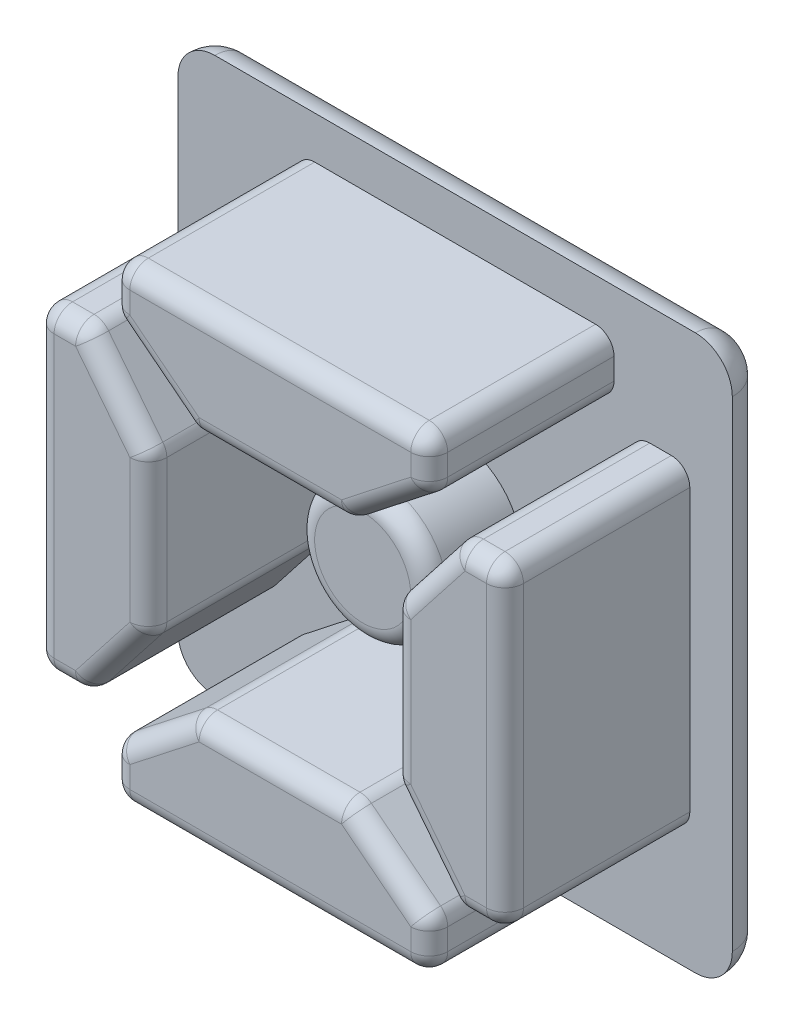
from build123d import *

# Parameters (mm, degrees)
ESQUISSE1_W                        = 30
ESQUISSE1_H                        = 30
BOSS_EXTRU_1_DEPTH                 = 2
BOSS_EXTRU_5_DEPTH                 = 10
CONG_1_R                           = 1
ESQUISSE2_R                        = 3.6
BOSS_EXTRU_6_DEPTH                 = 5
R_P_TITION_CIRCULAIRE1_COUNT       = 4
CONG_1_OF_R_P_TITION_CIRCULAIRE1_R = 1
CONG_2_R                           = 2
CONG_3_R                           = 1
CONG_4_R                           = 2


with BuildPart() as part:
    # Esquisse1 → Boss.-Extru.1 (new body)
    with BuildSketch(Plane.XY):
        with Locations((15, 15)):
            Rectangle(ESQUISSE1_W, ESQUISSE1_H)
    extrude(amount=BOSS_EXTRU_1_DEPTH)

    # Esquisse5 → Boss.-Extru.5 (add)
    with BuildSketch(Plane.XY.offset(2)):
        Polygon((27.7, 6.4), (27.7, 23.6), (25.05, 23.6), (21.6, 19.2), (21.6, 10.8), (25.05, 6.4), align=None)
    boss_extru_5 = extrude(amount=BOSS_EXTRU_5_DEPTH)

    # Congé1
    cong_1_edges = [part.edges().sort_by_distance(p)[0] for p in [
        (25.05, 6.4, 7),
        (27.7, 6.4, 7),
        (27.7, 23.6, 7),
        (25.05, 23.6, 7),
        (21.6, 19.2, 7),
        (21.6, 10.8, 7),
    ]]
    fillet(cong_1_edges, radius=CONG_1_R)

    # Esquisse2 → Boss.-Extru.6 (add)
    with BuildSketch(Plane.XY.offset(2)):
        with Locations(Location((15, 15, 0), (0, 0, 180))):
            Circle(ESQUISSE2_R)
    extrude(amount=BOSS_EXTRU_6_DEPTH)

    # Répétition circulaire1: Boss.-Extru.5 ×4 about axis
    r_p_tition_circulaire1_axis = Axis((15, 15, 0), (0, 0, 1))
    for i in range(1, R_P_TITION_CIRCULAIRE1_COUNT):
        add(boss_extru_5.rotate(r_p_tition_circulaire1_axis, i * 360 / R_P_TITION_CIRCULAIRE1_COUNT))

    # Congé1 of Répétition circulaire1
    cong_1_of_r_p_tition_circulaire1_edges = [part.edges().sort_by_distance(p)[0] for p in [
        (23.6, 25.05, 7),
        (23.6, 27.7, 7),
        (6.4, 27.7, 7),
        (6.4, 25.05, 7),
        (10.8, 21.6, 7),
        (19.2, 21.6, 7),
        (4.95, 23.6, 7),
        (2.3, 23.6, 7),
        (2.3, 6.4, 7),
        (4.95, 6.4, 7),
        (8.4, 10.8, 7),
        (8.4, 19.2, 7),
        (6.4, 4.95, 7),
        (6.4, 2.3, 7),
        (23.6, 2.3, 7),
        (23.6, 4.95, 7),
        (19.2, 8.4, 7),
        (10.8, 8.4, 7),
    ]]
    fillet(cong_1_of_r_p_tition_circulaire1_edges, radius=CONG_1_OF_R_P_TITION_CIRCULAIRE1_R)

    # Congé2
    cong_2_edges = [part.edges().sort_by_distance(p)[0] for p in [
        (0, 30, 1),
        (30, 30, 1),
        (30, 0, 1),
        (0, 0, 1),
    ]]
    fillet(cong_2_edges, radius=CONG_2_R)

    # Congé3
    cong_3_edges = [part.edges().sort_by_distance(p)[0] for p in [
        (15, 27.7, 12),
        (23.6, 26.118328167, 12),
        (6.4, 26.118328167, 12),
        (8.655619048, 23.28138961, 12),
        (15, 21.6, 12),
        (21.344380952, 23.28138961, 12),
        (6.500824998, 25.099067124, 12),
        (10.818910387, 21.654764961, 12),
        (19.181089613, 21.654764961, 12),
        (23.499175002, 25.099067124, 12),
        (6.692893219, 27.407106781, 12),
        (23.307106781, 27.407106781, 12),
        (2.3, 15, 12),
        (3.881671833, 23.6, 12),
        (3.881671833, 6.4, 12),
        (6.71861039, 8.655619048, 12),
        (8.4, 15, 12),
        (6.71861039, 21.344380952, 12),
        (4.900932876, 6.500824998, 12),
        (8.345235039, 10.818910387, 12),
        (8.345235039, 19.181089613, 12),
        (4.900932876, 23.499175002, 12),
        (2.592893219, 6.692893219, 12),
        (2.592893219, 23.307106781, 12),
        (15, 2.3, 12),
        (6.4, 3.881671833, 12),
        (23.6, 3.881671833, 12),
        (21.344380952, 6.71861039, 12),
        (15, 8.4, 12),
        (8.655619048, 6.71861039, 12),
        (23.499175002, 4.900932876, 12),
        (19.181089613, 8.345235039, 12),
        (10.818910387, 8.345235039, 12),
        (6.500824998, 4.900932876, 12),
        (23.307106781, 2.592893219, 12),
        (6.692893219, 2.592893219, 12),
        (27.7, 15, 12),
        (26.118328167, 6.4, 12),
        (26.118328167, 23.6, 12),
        (23.28138961, 21.344380952, 12),
        (21.6, 15, 12),
        (23.28138961, 8.655619048, 12),
        (25.099067124, 23.499175002, 12),
        (21.654764961, 19.181089613, 12),
        (21.654764961, 10.818910387, 12),
        (25.099067124, 6.500824998, 12),
        (27.407106781, 23.307106781, 12),
        (27.407106781, 6.692893219, 12),
        (18.6, 15, 7),
    ]]
    fillet(cong_3_edges, radius=CONG_3_R)

    # Congé4
    cong_4_edges = [part.edges().sort_by_distance(p)[0] for p in [
        (29.414213562, 29.414213562, 0),
        (15, 30, 0),
        (0.585786438, 29.414213562, 0),
        (0, 15, 0),
        (0.585786438, 0.585786438, 0),
        (15, 0, 0),
        (29.414213562, 0.585786438, 0),
        (30, 15, 0),
    ]]
    fillet(cong_4_edges, radius=CONG_4_R - 0.0001)  # a hair under: the kernel refuses the full size


solid = part.part
